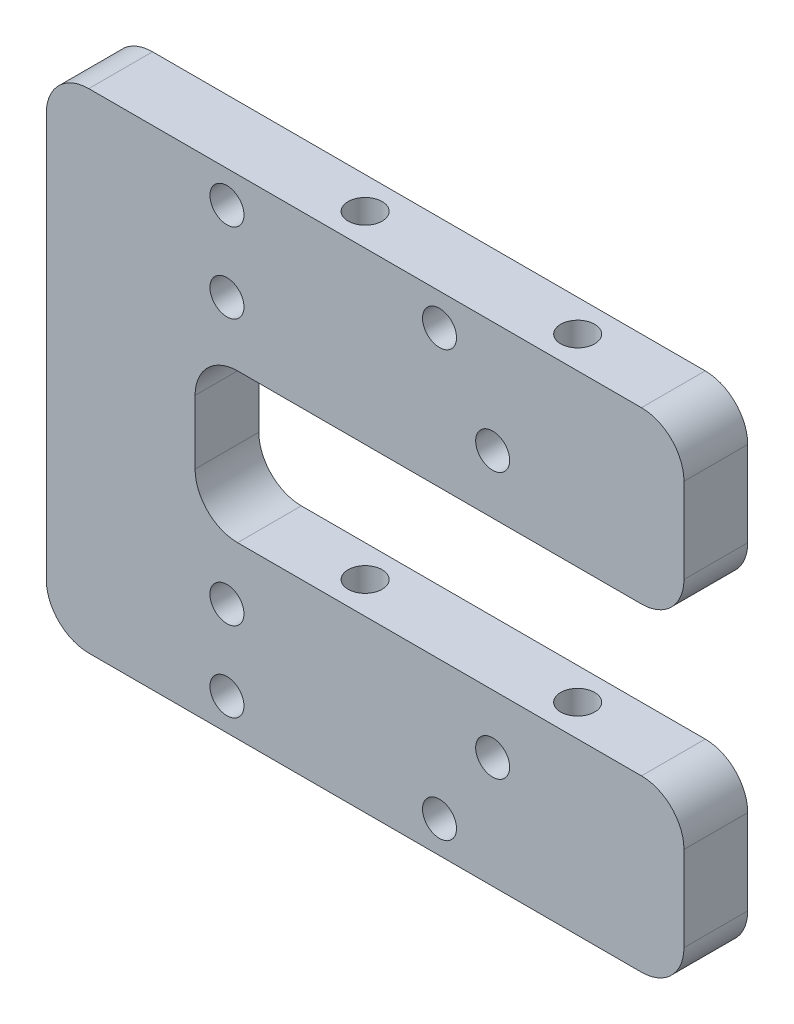
from build123d import *

# Parameters (mm, degrees)
SKETCH_1_R          = 1.6
EXTRUDE_1_DEPTH     = 6
FILLET_1_R          = 4
SKETCH_2_R          = 1.6
CUT_EXTRUDE_1_DEPTH = 10
SKETCH_3_R          = 1.6
CUT_EXTRUDE_2_DEPTH = 67


with BuildPart() as part:
    # 草图1 → 凸台-拉伸1 (new body)
    with BuildSketch(Plane.XY):
        Polygon((0, 46), (0, 0), (60, 0), (60, 16), (14, 16), (14, 30), (60, 30), (60, 46), align=None)
        with Locations((17, 35.5)):
            Circle(SKETCH_1_R, mode=Mode.SUBTRACT)
        with Locations((42, 35.5)):
            Circle(SKETCH_1_R, mode=Mode.SUBTRACT)
        with Locations((42, 10.5)):
            Circle(SKETCH_1_R, mode=Mode.SUBTRACT)
        with Locations((17, 10.5)):
            Circle(SKETCH_1_R, mode=Mode.SUBTRACT)
    extrude(amount=EXTRUDE_1_DEPTH)

    # 圆角1
    fillet_1_edges = [part.edges().sort_by_distance(p)[0] for p in [
        (0, 46, 3),
        (60, 46, 3),
        (60, 30, 3),
        (14, 30, 3),
        (14, 16, 3),
        (60, 16, 3),
        (0, 0, 3),
        (60, 0, 3),
    ]]
    fillet(fillet_1_edges, radius=FILLET_1_R)

    # 草图2 → 切除-拉伸1 (cut)
    with BuildSketch(Plane.XY.offset(6)):
        with Locations((17, 3)):
            Circle(SKETCH_2_R)
        with Locations((37, 3)):
            Circle(SKETCH_2_R)
        with Locations((37, 43)):
            Circle(SKETCH_2_R)
        with Locations((17, 43)):
            Circle(SKETCH_2_R)
    extrude(amount=-CUT_EXTRUDE_1_DEPTH, mode=Mode.SUBTRACT)

    # 草图3 → 切除-拉伸2 (cut)
    with BuildSketch(Plane(origin=(0, 46, 0), x_dir=(1, 0, 0), z_dir=(0, 1, 0))):
        with Locations((27, -3)):
            Circle(SKETCH_3_R)
        with Locations((47, -3)):
            Circle(SKETCH_3_R)
    extrude(amount=-CUT_EXTRUDE_2_DEPTH, mode=Mode.SUBTRACT)


solid = part.part
